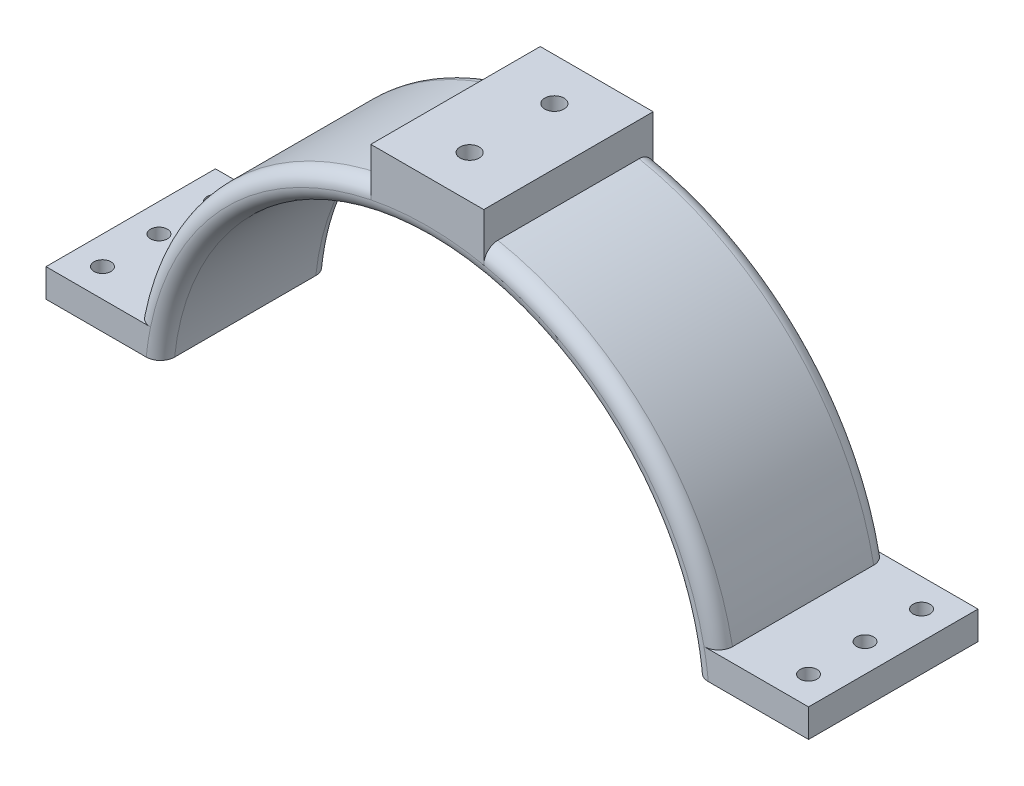
from build123d import *

# Parameters (mm, degrees)
BOSS_EXTRUDE1_DEPTH                             = 30
FILLET1_R                                       = 2.5
SKETCH6_R                                       = 3.75
CUT_EXTRUDE1_DEPTH                              = 47.5
CSK_FOR_M3_FLAT_HEAD_MACHINE_SCREW1_D           = 3.4
CSK_FOR_M3_FLAT_HEAD_MACHINE_SCREW1_CSINK_D     = 6.3
CSK_FOR_M3_FLAT_HEAD_MACHINE_SCREW1_CSINK_ANGLE = 90
F_3_0MM_DOWEL_HOLE1_D                           = 3


with BuildPart() as part:
    # Sketch1 → Boss-Extrude1 (new body)
    with BuildSketch(Plane.XY):
        with BuildLine():
            Line((47.236109069, 5), (67.5, 5))
            Line((67.5, 5), (67.5, 10))
            Line((67.5, 10), (51.53882032, 10))
            ThreePointArc((51.53882032, 10), (37.123106012, 37.123106012), (10, 51.53882032))
            Line((10, 51.53882032), (10, 57.5))
            Line((10, 57.5), (-10, 57.5))
            Line((-10, 57.5), (-10, 51.53882032))
            ThreePointArc((-10, 51.53882032), (-37.123106012, 37.123106012), (-51.53882032, 10))
            Line((-51.53882032, 10), (-67.5, 10))
            Line((-67.5, 10), (-67.5, 5))
            Line((-67.5, 5), (-47.236109069, 5))
            ThreePointArc((-47.236109069, 5), (0, 47.5), (47.236109069, 5))
        make_face()
    extrude(amount=BOSS_EXTRUDE1_DEPTH)

    # Fillet1
    fillet1_edges = [part.edges().sort_by_distance(p)[0] for p in [
        (37.123106012, 37.123106012, 0),
        (0, 47.5, 0),
        (-37.123106012, 37.123106012, 0),
        (0, 47.5, 30),
        (37.123106012, 37.123106012, 30),
        (-37.123106012, 37.123106012, 30),
    ]]
    fillet(fillet1_edges, radius=FILLET1_R - 0.0001)  # a hair under: the kernel refuses the full size

    # Sketch6 → Cut-Extrude1 (cut)
    with BuildSketch(Plane.XZ.offset(-5)):
        with Locations(Location((0, 22.5, 0), (0, 0, 270))):
            Circle(SKETCH6_R)
        with Locations(Location((0, 7.5, 0), (0, 0, 270))):
            Circle(SKETCH6_R)
    extrude(amount=-CUT_EXTRUDE1_DEPTH, mode=Mode.SUBTRACT)

    # CSK for M3 Flat Head Machine Screw1 (through all)
    with Locations(Plane(origin=(0, 52.5, 0), x_dir=(-1, 0, 0), z_dir=(0, -1, 0))):
        with Locations((0, -22.5), (0, -7.5)):
            CounterSinkHole(CSK_FOR_M3_FLAT_HEAD_MACHINE_SCREW1_D / 2, CSK_FOR_M3_FLAT_HEAD_MACHINE_SCREW1_CSINK_D / 2, counter_sink_angle=CSK_FOR_M3_FLAT_HEAD_MACHINE_SCREW1_CSINK_ANGLE)

    # Ø3.0mm Dowel Hole1 (through all)
    with Locations(Plane(origin=(0, 10, 0), x_dir=(1, 0, 0), z_dir=(0, 1, 0))):
        with Locations((-62.5, -5), (-62.5, -15), (-62.5, -25), (62.5, -5), (62.5, -15), (62.5, -25)):
            Hole(F_3_0MM_DOWEL_HOLE1_D / 2)


solid = part.part
